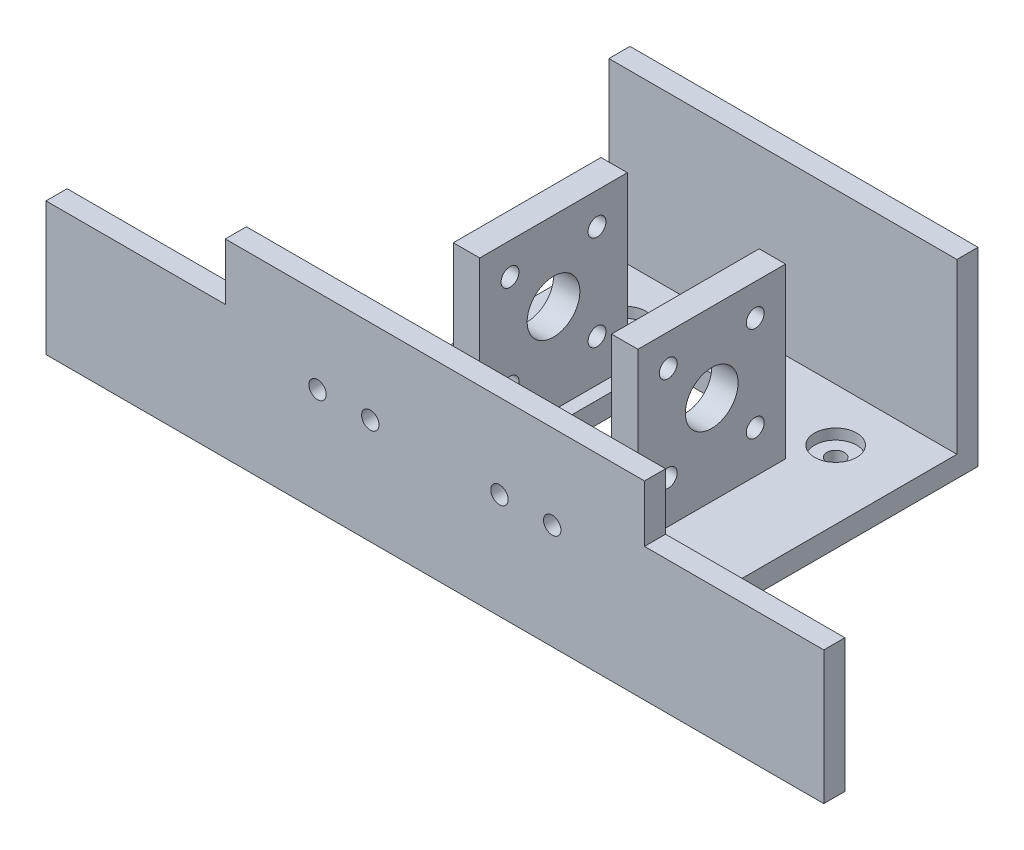
from build123d import *

# Parameters (mm, degrees)
SKETCH1_W                 = 75
SKETCH1_H                 = 40
SKETCH1_R                 = 5
SKETCH1_R_2               = 1.7
SKETCH1_W_2               = 10
SKETCH1_H_2               = 20
BOSS_EXTRUDE1_DEPTH       = 3
CUT_EXTRUDE1_DEPTH        = 43.605750786
CUT_EXTRUDE1_DEPTH_BACK   = 43.605750786
SKETCH2_W                 = 67
SKETCH2_H                 = 28
BOSS_EXTRUDE3_DEPTH       = 110
BOSS_EXTRUDE3_DEPTH_BACK  = 3
SKETCH3_W                 = 75
SKETCH3_H                 = 70
SKETCH3_W_2               = 67
SKETCH3_H_2               = 40
SKETCH6_W                 = 67
SKETCH6_H                 = 11
CUT_EXTRUDE4_DEPTH        = 122.372360939
SKETCH7_W                 = 70
SKETCH7_H                 = 37
BOSS_EXTRUDE4_DEPTH       = 45
SKETCH8_W                 = 45
SKETCH8_H                 = 62
CUT_EXTRUDE6_DEPTH        = 29
SKETCH11_W                = 45
SKETCH11_H                = 4
CUT_EXTRUDE9_DEPTH        = 157.445677473
SKETCH9_W                 = 38
SKETCH9_H                 = 28.5
CUT_EXTRUDE10_DEPTH       = 204.024629048
SKETCH13_W                = 5
SKETCH13_H                = 38
BOSS_EXTRUDE5_DEPTH       = 32
SKETCH14_R                = 5
SKETCH14_R_2              = 1.7
CUT_EXTRUDE11_DEPTH       = 32
SKETCH15_W                = 165
SKETCH15_H                = 70
SKETCH15_W_2              = 157
SKETCH15_H_2              = 62
BOSS_EXTRUDE6_DEPTH       = 3
SKETCH16_W                = 20
SKETCH16_H                = 4.820648258
CUT_EXTRUDE12_DEPTH       = 159.626132778
SKETCH18_R                = 1.65
CUT_EXTRUDE14_DEPTH       = 159.626132778
MIRROR6_COPY_1_SKETCH_W   = 5
MIRROR6_COPY_1_SKETCH_H   = 38
MIRROR6_COPY_1_DEPTH      = 32
MIRROR6_COPY_2_SKETCH_R   = 5
MIRROR6_COPY_2_SKETCH_R_2 = 1.7
MIRROR6_COPY_2_DEPTH      = 32
MIRROR6_COPY_3_SKETCH_W   = 5
MIRROR6_COPY_3_SKETCH_H   = 38
MIRROR6_COPY_3_DEPTH      = 32
MIRROR6_COPY_4_SKETCH_R   = 5
MIRROR6_COPY_4_SKETCH_R_2 = 1.7
MIRROR6_COPY_4_DEPTH      = 32
SKETCH19_W                = 38
SKETCH19_H                = 3.5
CUT_EXTRUDE15_DEPTH       = 10
SKETCH20_R                = 1.2
CUT_EXTRUDE16_DEPTH       = 10
SKETCH21_W                = 10
SKETCH21_H                = 80
CUT_EXTRUDE17_DEPTH       = 184.330984833
SKETCH22_W                = 55
SKETCH22_H                = 80
CUT_EXTRUDE18_DEPTH       = 184.330984833
SKETCH23_W                = 67
SKETCH23_H                = 62
BOSS_EXTRUDE7_DEPTH       = 4
SKETCH24_R                = 10
SKETCH24_R_2              = 1.65
CUT_EXTRUDE19_DEPTH       = 111.123793978
CUT_EXTRUDE21_START       = -16
SKETCH25_R                = 1.65
CUT_EXTRUDE21_DEPTH       = 16
SKETCH26_W                = 14.5
SKETCH26_H                = 36
CUT_EXTRUDE22_DEPTH       = 178.837706913
SKETCH27_W                = 5
SKETCH27_H                = 64
CUT_EXTRUDE23_DEPTH       = 43
CUT_EXTRUDE24_DEPTH       = 100.724620832
SKETCH29_R                = 4
SKETCH29_R_2              = 1.65
CUT_EXTRUDE25_DEPTH       = 2
SKETCH30_W                = 5
SKETCH30_H                = 28
BOSS_EXTRUDE8_DEPTH       = 32
CUT_EXTRUDE26_START       = -32
SKETCH32_R                = 5
SKETCH32_R_2              = 1.7
CUT_EXTRUDE26_DEPTH       = 32
CUT_EXTRUDE27_DEPTH       = 32
SKETCH36_R                = 1.65
CUT_EXTRUDE28_DEPTH       = 10
SKETCH37_W                = 6.586786374
SKETCH37_H                = 6.17536381
BOSS_EXTRUDE9_DEPTH       = 4
SKETCH38_W                = 28.25
SKETCH38_H                = 10.75
CUT_EXTRUDE29_DEPTH       = 10
SKETCH39_W                = 5.75
SKETCH39_H                = 25.25
BOSS_EXTRUDE10_DEPTH      = 4


with BuildPart() as part:
    # Sketch1 → Boss-Extrude1 (new body)
    with BuildSketch(Plane(origin=(0, 0, 0), x_dir=(1, 0, 0), z_dir=(0, 1, 0))):
        Rectangle(SKETCH1_W, SKETCH1_H)
        with Locations((-21, 0)):
            Circle(SKETCH1_R, mode=Mode.SUBTRACT)
        with Locations((-30, 8.25)):
            Circle(SKETCH1_R_2, mode=Mode.SUBTRACT)
        with Locations((-12, 8.25)):
            Circle(SKETCH1_R_2, mode=Mode.SUBTRACT)
        with Locations((-12, -8.25)):
            Circle(SKETCH1_R_2, mode=Mode.SUBTRACT)
        with Locations((-30, -8.25)):
            Circle(SKETCH1_R_2, mode=Mode.SUBTRACT)
        with Locations((12, 8.25)):
            Circle(SKETCH1_R_2, mode=Mode.SUBTRACT)
        with Locations((12, -8.25)):
            Circle(SKETCH1_R_2, mode=Mode.SUBTRACT)
        with Locations((21, 0)):
            Circle(SKETCH1_R, mode=Mode.SUBTRACT)
        with Locations((30, -8.25)):
            Circle(SKETCH1_R_2, mode=Mode.SUBTRACT)
        with Locations((30, 8.25)):
            Circle(SKETCH1_R_2, mode=Mode.SUBTRACT)
        Rectangle(SKETCH1_W_2, SKETCH1_H_2, mode=Mode.SUBTRACT)
    extrude(amount=BOSS_EXTRUDE1_DEPTH)

    # Sketch2 → Cut-Extrude1 (cut, two sides: drawn at the far end of the back side and taken through both)
    with BuildSketch(Plane(origin=(0, 3, 0), x_dir=(1, 0, 0), z_dir=(0, 1, 0)).offset(-CUT_EXTRUDE1_DEPTH_BACK)):
        Rectangle(SKETCH2_W, SKETCH2_H)
    extrude(amount=CUT_EXTRUDE1_DEPTH + CUT_EXTRUDE1_DEPTH_BACK, mode=Mode.SUBTRACT)

    # Sketch3 → Boss-Extrude3 (add, two sides: drawn at the far end of the back side and taken through both)
    with BuildSketch(Plane(origin=(0, 3, 0), x_dir=(1, 0, 0), z_dir=(0, 1, 0)).offset(-BOSS_EXTRUDE3_DEPTH_BACK)):
        Rectangle(SKETCH3_W, SKETCH3_H)
        Rectangle(SKETCH3_W_2, SKETCH3_H_2, mode=Mode.SUBTRACT)
    extrude(amount=BOSS_EXTRUDE3_DEPTH + BOSS_EXTRUDE3_DEPTH_BACK)

    # Sketch6 → Cut-Extrude4 (cut, through all)
    with BuildSketch(Plane(origin=(0, 3, 0), x_dir=(1, 0, 0), z_dir=(0, 1, 0))):
        with Locations((0, -25.5)):
            Rectangle(SKETCH6_W, SKETCH6_H)
        with Locations((0, 25.5)):
            Rectangle(SKETCH6_W, SKETCH6_H)
    extrude(amount=CUT_EXTRUDE4_DEPTH, mode=Mode.SUBTRACT)

    # Sketch7 → Boss-Extrude4 (add)
    with BuildSketch(Plane.ZY.offset(37.5)):
        with Locations((0, 94.5)):
            Rectangle(SKETCH7_W, SKETCH7_H)
    boss_extrude4 = extrude(amount=BOSS_EXTRUDE4_DEPTH)

    # Mirror2: Boss-Extrude4 across plane
    add(boss_extrude4.mirror(Plane(origin=(0, 0, 0), x_dir=(0, 0, 1), z_dir=(1, 0, 0))))

    # Sketch8 → Cut-Extrude6 (cut)
    with BuildSketch(Plane(origin=(0, 113, 0), x_dir=(1, 0, 0), z_dir=(0, 1, 0))):
        with Locations((-56, 0)):
            Rectangle(SKETCH8_W, SKETCH8_H)
        with Locations((56, 0)):
            Rectangle(SKETCH8_W, SKETCH8_H)
    extrude(amount=-CUT_EXTRUDE6_DEPTH, mode=Mode.SUBTRACT)

    # Sketch11 → Cut-Extrude9 (cut, through all)
    with BuildSketch(Plane.XY.offset(35)):
        with Locations((-60, 78)):
            Rectangle(SKETCH11_W, SKETCH11_H)
        with Locations((60, 78)):
            Rectangle(SKETCH11_W, SKETCH11_H)
    extrude(amount=-CUT_EXTRUDE9_DEPTH, mode=Mode.SUBTRACT)

    # Sketch9 → Cut-Extrude10 (cut, through all)
    with BuildSketch(Plane.ZY.offset(82.5)):
        with Locations((0, 98.25)):
            Rectangle(SKETCH9_W, SKETCH9_H)
    extrude(amount=-CUT_EXTRUDE10_DEPTH, mode=Mode.SUBTRACT)

    # Sketch13 → Boss-Extrude5 (add)
    with BuildSketch(Plane(origin=(0, 84, 0), x_dir=(1, 0, 0), z_dir=(0, 1, 0))):
        with Locations((-39, 0)):
            Rectangle(SKETCH13_W, SKETCH13_H)
    boss_extrude5 = extrude(amount=BOSS_EXTRUDE5_DEPTH)

    # Sketch14 → Cut-Extrude11 (cut)
    with BuildSketch(Plane.ZY.offset(41.5)):
        with Locations((0, 101)):
            Circle(SKETCH14_R)
        with Locations((-8.25, 110)):
            Circle(SKETCH14_R_2)
        with Locations((8.25, 110)):
            Circle(SKETCH14_R_2)
        with Locations((8.25, 92)):
            Circle(SKETCH14_R_2)
        with Locations((-8.25, 92)):
            Circle(SKETCH14_R_2)
    cut_extrude11 = extrude(amount=-CUT_EXTRUDE11_DEPTH, mode=Mode.SUBTRACT)

    # Mirror4: Boss-Extrude5, Cut-Extrude11 across plane
    add(boss_extrude5.mirror(Plane(origin=(0, 0, 0), x_dir=(0, 0, 1), z_dir=(1, 0, 0))))
    add(cut_extrude11.mirror(Plane(origin=(0, 0, 0), x_dir=(0, 0, 1), z_dir=(1, 0, 0))), mode=Mode.SUBTRACT)

    # Sketch15 → Boss-Extrude6 (add)
    with BuildSketch(Plane(origin=(0, 113, 0), x_dir=(1, 0, 0), z_dir=(0, 1, 0))):
        Rectangle(SKETCH15_W, SKETCH15_H)
        Rectangle(SKETCH15_W_2, SKETCH15_H_2, mode=Mode.SUBTRACT)
    extrude(amount=BOSS_EXTRUDE6_DEPTH)

    # Sketch16 → Cut-Extrude12 (cut, through all)
    with BuildSketch(Plane.XY.offset(35)):
        with Locations((0, 11.636111214)):
            Rectangle(SKETCH16_W, SKETCH16_H)
    extrude(amount=-CUT_EXTRUDE12_DEPTH, mode=Mode.SUBTRACT)

    # Sketch18 → Cut-Extrude14 (cut, through all)
    with BuildSketch(Plane.XY.offset(35)):
        with Locations((52.25, 100)):
            Circle(SKETCH18_R)
    cut_extrude14 = extrude(amount=-CUT_EXTRUDE14_DEPTH, mode=Mode.SUBTRACT)

    # Mirror5: Cut-Extrude14 across plane
    add(cut_extrude14.mirror(Plane(origin=(0, 0, 0), x_dir=(0, 0, 1), z_dir=(1, 0, 0))), mode=Mode.SUBTRACT)

    # Mirror6 copy 1 sketch → Mirror6 copy 1 (add)
    with BuildSketch(Plane(origin=(0, 148, 0), x_dir=(-1, 0, 0), z_dir=(0, -1, 0))):
        with Locations((-39, 0)):
            Rectangle(MIRROR6_COPY_1_SKETCH_W, MIRROR6_COPY_1_SKETCH_H)
    extrude(amount=MIRROR6_COPY_1_DEPTH)

    # Mirror6 copy 2 sketch → Mirror6 copy 2 (cut)
    with BuildSketch(Plane(origin=(41.5, 232, 0), x_dir=(0, 0, 1), z_dir=(1, 0, 0))):
        with Locations((0, 101)):
            Circle(MIRROR6_COPY_2_SKETCH_R)
        with Locations((-8.25, 110)):
            Circle(MIRROR6_COPY_2_SKETCH_R_2)
        with Locations((8.25, 110)):
            Circle(MIRROR6_COPY_2_SKETCH_R_2)
        with Locations((8.25, 92)):
            Circle(MIRROR6_COPY_2_SKETCH_R_2)
        with Locations((-8.25, 92)):
            Circle(MIRROR6_COPY_2_SKETCH_R_2)
    extrude(amount=-MIRROR6_COPY_2_DEPTH, mode=Mode.SUBTRACT)

    # Mirror6 copy 3 sketch → Mirror6 copy 3 (add)
    with BuildSketch(Plane.XZ.offset(-148)):
        with Locations((-39, 0)):
            Rectangle(MIRROR6_COPY_3_SKETCH_W, MIRROR6_COPY_3_SKETCH_H)
    extrude(amount=MIRROR6_COPY_3_DEPTH)

    # Mirror6 copy 4 sketch → Mirror6 copy 4 (cut)
    with BuildSketch(Plane(origin=(-41.5, 232, 0), x_dir=(0, 0, 1), z_dir=(-1, 0, 0))):
        with Locations((0, -101)):
            Circle(MIRROR6_COPY_4_SKETCH_R)
        with Locations((-8.25, -110)):
            Circle(MIRROR6_COPY_4_SKETCH_R_2)
        with Locations((8.25, -110)):
            Circle(MIRROR6_COPY_4_SKETCH_R_2)
        with Locations((8.25, -92)):
            Circle(MIRROR6_COPY_4_SKETCH_R_2)
        with Locations((-8.25, -92)):
            Circle(MIRROR6_COPY_4_SKETCH_R_2)
    extrude(amount=-MIRROR6_COPY_4_DEPTH, mode=Mode.SUBTRACT)

    # Sketch19 → Cut-Extrude15 (cut)
    with BuildSketch(Plane(origin=(82.5, 0, 0), x_dir=(0, 0, -1), z_dir=(1, 0, 0))):
        with Locations((0, 114.25)):
            Rectangle(SKETCH19_W, SKETCH19_H)
    cut_extrude15 = extrude(amount=-CUT_EXTRUDE15_DEPTH, mode=Mode.SUBTRACT)

    # Mirror7: Cut-Extrude15 across plane
    add(cut_extrude15.mirror(Plane(origin=(0, 0, 0), x_dir=(0, 0, 1), z_dir=(1, 0, 0))), mode=Mode.SUBTRACT)

    # Sketch20 → Cut-Extrude16 (cut)
    with BuildSketch(Plane(origin=(0, 3, 0), x_dir=(1, 0, 0), z_dir=(0, 1, 0))):
        with Locations((-12, 17.5)):
            Circle(SKETCH20_R)
        with Locations((-12, -17.5)):
            Circle(SKETCH20_R)
        with Locations((-24, -17.5)):
            Circle(SKETCH20_R)
        with Locations((-24, 17.5)):
            Circle(SKETCH20_R)
        with Locations((12, -17.5)):
            Circle(SKETCH20_R)
        with Locations((24, -17.5)):
            Circle(SKETCH20_R)
        with Locations((12, 17.5)):
            Circle(SKETCH20_R)
        with Locations((24, 17.5)):
            Circle(SKETCH20_R)
    extrude(amount=-CUT_EXTRUDE16_DEPTH, mode=Mode.SUBTRACT)

    # Sketch21 → Cut-Extrude17 (cut, through all)
    with BuildSketch(Plane.XY.offset(35)):
        with Locations((32.5, 40)):
            Rectangle(SKETCH21_W, SKETCH21_H)
        with Locations((-32.5, 40)):
            Rectangle(SKETCH21_W, SKETCH21_H)
    extrude(amount=-CUT_EXTRUDE17_DEPTH, mode=Mode.SUBTRACT)

    # Sketch22 → Cut-Extrude18 (cut, through all)
    with BuildSketch(Plane.XY.offset(35)):
        with Locations((0, 40)):
            Rectangle(SKETCH22_W, SKETCH22_H)
    extrude(amount=-CUT_EXTRUDE18_DEPTH, mode=Mode.SUBTRACT)

    # Sketch23 → Boss-Extrude7 (add)
    with BuildSketch(Plane.XZ.offset(-80)):
        Rectangle(SKETCH23_W, SKETCH23_H)
    extrude(amount=-BOSS_EXTRUDE7_DEPTH)

    # Sketch24 → Cut-Extrude19 (cut, through all)
    with BuildSketch(Plane(origin=(0, 84, 0), x_dir=(1, 0, 0), z_dir=(0, 1, 0))):
        Circle(SKETCH24_R)
        with Locations((-20, 21)):
            Circle(SKETCH24_R_2)
        with Locations((-20, -21)):
            Circle(SKETCH24_R_2)
        with Locations((20, -21)):
            Circle(SKETCH24_R_2)
        with Locations((20, 21)):
            Circle(SKETCH24_R_2)
    extrude(amount=-CUT_EXTRUDE19_DEPTH, mode=Mode.SUBTRACT)

    # Sketch25 → Cut-Extrude21 (cut)
    with BuildSketch(Plane(origin=(0, 0, -35), x_dir=(-1, 0, 0), z_dir=(0, 0, -1)).offset(CUT_EXTRUDE21_START)):
        Polygon((33.5, 116), (33.5, 84), (33.5, 80), (82.5, 80), (82.5, 116), align=None)
        with Locations((52.25, 100)):
            Circle(SKETCH25_R, mode=Mode.SUBTRACT)
    cut_extrude21 = extrude(amount=CUT_EXTRUDE21_DEPTH, mode=Mode.SUBTRACT)

    # Mirror8: Cut-Extrude21 across plane
    add(cut_extrude21.mirror(Plane(origin=(0, 0, 0), x_dir=(0, 0, 1), z_dir=(1, 0, 0))), mode=Mode.SUBTRACT)

    # Sketch26 → Cut-Extrude22 (cut, through all)
    with BuildSketch(Plane(origin=(0, 0, -19), x_dir=(-1, 0, 0), z_dir=(0, 0, -1))):
        with Locations((75.25, 98)):
            Rectangle(SKETCH26_W, SKETCH26_H)
    cut_extrude22 = extrude(amount=-CUT_EXTRUDE22_DEPTH, mode=Mode.SUBTRACT)

    # Mirror9: Cut-Extrude22 across plane
    add(cut_extrude22.mirror(Plane(origin=(0, 0, 0), x_dir=(0, 0, 1), z_dir=(1, 0, 0))), mode=Mode.SUBTRACT)

    # Sketch27 → Cut-Extrude23 (cut)
    with BuildSketch(Plane(origin=(0, 0, -19), x_dir=(-1, 0, 0), z_dir=(0, 0, -1))):
        with Locations((-39, 116)):
            Rectangle(SKETCH27_W, SKETCH27_H)
    extrude(amount=-CUT_EXTRUDE23_DEPTH, mode=Mode.SUBTRACT)

    # Sketch28 → Cut-Extrude24 (cut, symmetric)
    with BuildSketch(Plane(origin=(0, 84, 0), x_dir=(1, 0, 0), z_dir=(0, 1, 0))):
        Polygon((68, 19), (33.5, 19), (33.5, 35), (33, 35), (33, 19), (33, -31), (68, -31), align=None)
    cut_extrude24 = extrude(amount=CUT_EXTRUDE24_DEPTH, both=True, mode=Mode.SUBTRACT)

    # Sketch29 → Cut-Extrude25 (cut)
    # profile 1 of 4: a face of its own
    with BuildSketch(Plane(origin=(0, 84, 0), x_dir=(1, 0, 0), z_dir=(0, 1, 0))):
        with Locations((-20, 21)):
            Circle(SKETCH29_R)
        with Locations((-20, 21)):
            Circle(SKETCH29_R_2, mode=Mode.SUBTRACT)
    # profile 2 of 4: a face of its own
    with BuildSketch(Plane(origin=(0, 84, 0), x_dir=(1, 0, 0), z_dir=(0, 1, 0))):
        with Locations((20, 21)):
            Circle(SKETCH29_R)
        with Locations((20, 21)):
            Circle(SKETCH29_R_2, mode=Mode.SUBTRACT)
    # profile 3 of 4: a face of its own
    with BuildSketch(Plane(origin=(0, 84, 0), x_dir=(1, 0, 0), z_dir=(0, 1, 0))):
        with Locations((20, -21)):
            Circle(SKETCH29_R)
        with Locations((20, -21)):
            Circle(SKETCH29_R_2, mode=Mode.SUBTRACT)
    # profile 4 of 4: a face of its own
    with BuildSketch(Plane(origin=(0, 84, 0), x_dir=(1, 0, 0), z_dir=(0, 1, 0))):
        with Locations((-20, -21)):
            Circle(SKETCH29_R)
        with Locations((-20, -21)):
            Circle(SKETCH29_R_2, mode=Mode.SUBTRACT)
    extrude(amount=-CUT_EXTRUDE25_DEPTH, mode=Mode.SUBTRACT)

    # Sketch30 → Boss-Extrude8 (add)
    with BuildSketch(Plane(origin=(0, 84, 0), x_dir=(1, 0, 0), z_dir=(0, 1, 0))):
        with Locations((15, 0)):
            Rectangle(SKETCH30_W, SKETCH30_H)
    boss_extrude8 = extrude(amount=BOSS_EXTRUDE8_DEPTH)

    # Sketch32 → Cut-Extrude26 (cut)
    with BuildSketch(Plane(origin=(17.5, 0, 0), x_dir=(0, 0, -1), z_dir=(1, 0, 0)).offset(CUT_EXTRUDE26_START)):
        with Locations((0, 101)):
            Circle(SKETCH32_R)
        with Locations((8.25, 110)):
            Circle(SKETCH32_R_2)
        with Locations((-8.25, 110)):
            Circle(SKETCH32_R_2)
        with Locations((-8.25, 92)):
            Circle(SKETCH32_R_2)
        with Locations((8.25, 92)):
            Circle(SKETCH32_R_2)
    cut_extrude26 = extrude(amount=CUT_EXTRUDE26_DEPTH, mode=Mode.SUBTRACT)

    # Mirror11: Cut-Extrude24 across plane
    add(cut_extrude24.mirror(Plane(origin=(0, 0, 0), x_dir=(0, 0, 1), z_dir=(1, 0, 0))), mode=Mode.SUBTRACT)

    # Mirror16: Boss-Extrude8 across plane
    add(boss_extrude8.mirror(Plane(origin=(0, 0, 0), x_dir=(0, 0, 1), z_dir=(1, 0, 0))))

    # Mirror18: Cut-Extrude26 across plane
    add(cut_extrude26.mirror(Plane(origin=(0, 0, 0), x_dir=(0, 0, 1), z_dir=(1, 0, 0))), mode=Mode.SUBTRACT)

    # Sketch34 → Cut-Extrude27 (cut)
    with BuildSketch(Plane(origin=(0, 84, 0), x_dir=(1, 0, 0), z_dir=(0, 1, 0))):
        with BuildLine():
            ThreePointArc((10, 0), (0, -10), (-10, 0))
            Line((-10, 0), (-10, -21))
            Line((-10, -21), (10, -21))
            Line((10, -21), (10, 0))
        make_face()
        with BuildLine():
            Line((-10, 21), (-10, 0))
            ThreePointArc((-10, 0), (0, 10), (10, 0))
            Line((10, 0), (10, 21))
            Line((10, 21), (-10, 21))
        make_face()
    extrude(amount=-CUT_EXTRUDE27_DEPTH, mode=Mode.SUBTRACT)

    # Sketch36 → Cut-Extrude28 (cut)
    with BuildSketch(Plane.XY.offset(35)):
        with Locations((22.25, 100)):
            Circle(SKETCH36_R)
        with Locations((12.25, 100)):
            Circle(SKETCH36_R)
        with Locations((-12.25, 100)):
            Circle(SKETCH36_R)
        with Locations((-22.25, 100)):
            Circle(SKETCH36_R)
    extrude(amount=-CUT_EXTRUDE28_DEPTH, mode=Mode.SUBTRACT)

    # Sketch37 → Boss-Extrude9 (add)
    with BuildSketch(Plane.XY.offset(35)):
        with Locations((52.25, 100)):
            Rectangle(SKETCH37_W, SKETCH37_H)
        with Locations((-52.25, 100)):
            Rectangle(SKETCH37_W, SKETCH37_H)
    extrude(amount=-BOSS_EXTRUDE9_DEPTH)

    # Sketch38 → Cut-Extrude29 (cut)
    with BuildSketch(Plane.XY.offset(35)):
        with Locations((-53.875, 110.625)):
            Rectangle(SKETCH38_W, SKETCH38_H)
        with Locations((53.875, 110.625)):
            Rectangle(SKETCH38_W, SKETCH38_H)
    extrude(amount=-CUT_EXTRUDE29_DEPTH, mode=Mode.SUBTRACT)

    # Sketch39 → Boss-Extrude10 (add)
    with BuildSketch(Plane.XY.offset(35)):
        with Locations((-70.875, 92.625)):
            Rectangle(SKETCH39_W, SKETCH39_H)
        with Locations((70.875, 92.625)):
            Rectangle(SKETCH39_W, SKETCH39_H)
    extrude(amount=-BOSS_EXTRUDE10_DEPTH)


solid = part.part
